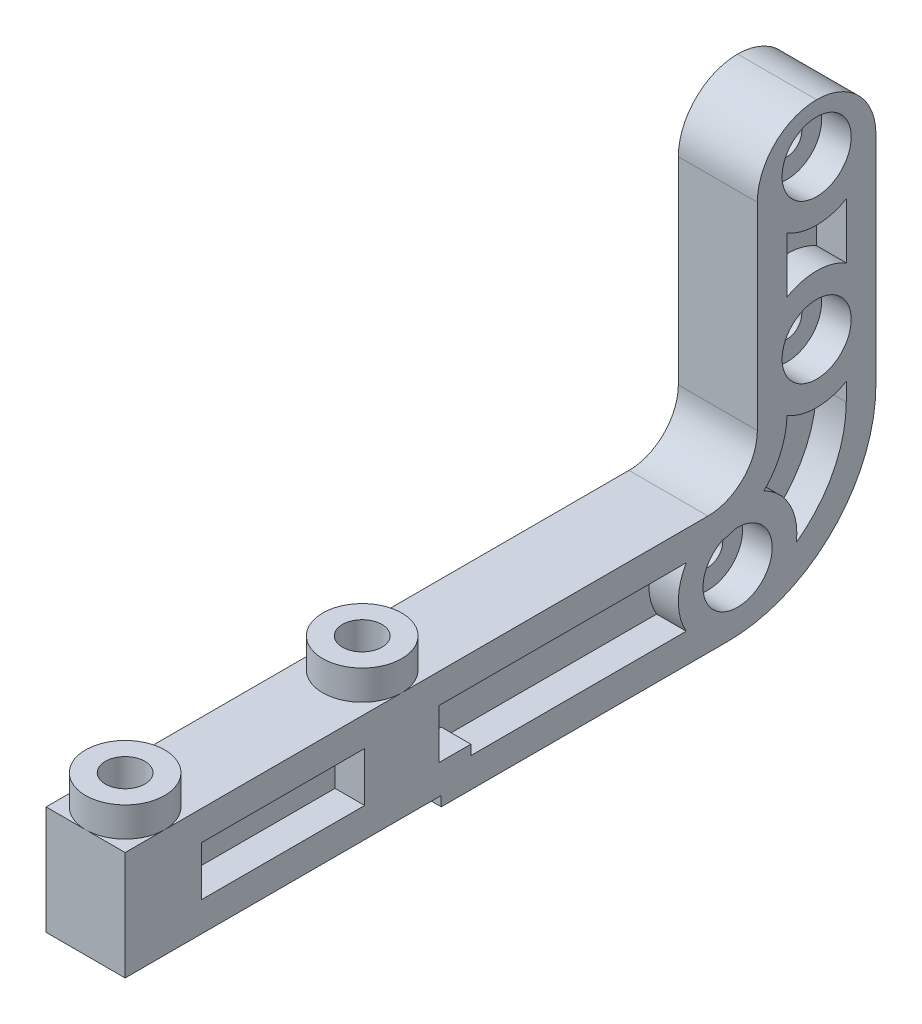
from build123d import *

# Parameters (mm, degrees)
SKETCH1_R           = 1.5
SKETCH1_W           = 12
SKETCH1_H           = 31
BOSS_EXTRUDE1_DEPTH = 8
FILLET1_R           = 6
FILLET2_R           = 15
FILLET3_R           = 5
SKETCH2_R           = 2
CUT_EXTRUDE1_DEPTH  = 50.689032995
BOSS_EXTRUDE2_START = 3
SKETCH3_R           = 4
SKETCH3_R_2         = 2
BOSS_EXTRUDE2_DEPTH = 3
CUT_EXTRUDE2_START  = -3
SKETCH4_W           = 16.5
SKETCH4_H           = 5
SKETCH4_R           = 1.5
CUT_EXTRUDE2_DEPTH  = 3


with BuildPart() as part:
    # Sketch1 → Boss-Extrude1 (new body)
    # profile 1 of 2: a face of its own
    with BuildSketch(Plane(origin=(0, 0, 0), x_dir=(0, 0, -1), z_dir=(1, 0, 0))):
        Polygon((-6, -5), (-6, -6), (38, -6), (38, 6), (26, 6), (-38, 6), (-38, -5), align=None)
        with Locations((24, 0)):
            Circle(SKETCH1_R, mode=Mode.SUBTRACT)
    # profile 2 of 2: a face of its own
    with BuildSketch(Plane(origin=(0, 0, 0), x_dir=(0, 0, -1), z_dir=(1, 0, 0))):
        with Locations((32, 21.5)):
            Rectangle(SKETCH1_W, SKETCH1_H)
        with Locations((32, 16)):
            Circle(SKETCH1_R, mode=Mode.SUBTRACT)
        with Locations((32, 32)):
            Circle(SKETCH1_R, mode=Mode.SUBTRACT)
    extrude(amount=BOSS_EXTRUDE1_DEPTH)

    # Fillet1
    fillet1_edges = [part.edges().sort_by_distance(p)[0] for p in [
        (4, 37, -26),
        (4, 37, -38),
    ]]
    fillet(fillet1_edges, radius=FILLET1_R - 0.0001)  # a hair under: the kernel refuses the full size

    # Fillet2
    fillet2_edges = [part.edges().sort_by_distance(p)[0] for p in [
        (4, -6, -38),
    ]]
    fillet(fillet2_edges, radius=FILLET2_R)

    # Fillet3
    fillet3_edges = [part.edges().sort_by_distance(p)[0] for p in [
        (4, 6, -26),
    ]]
    fillet(fillet3_edges, radius=FILLET3_R)

    # Sketch2 → Cut-Extrude1 (cut, through all)
    with BuildSketch(Plane(origin=(0, 6, 0), x_dir=(1, 0, 0), z_dir=(0, 1, 0))):
        with Locations(Location((4, -34, 0), (0, 0, 270))):
            Circle(SKETCH2_R)
        with Locations(Location((4, -10, 0), (0, 0, 270))):
            Circle(SKETCH2_R)
    extrude(amount=-CUT_EXTRUDE1_DEPTH, mode=Mode.SUBTRACT)

    # Sketch3 → Boss-Extrude2 (add)
    # profile 1 of 2: a face of its own
    with BuildSketch(Plane(origin=(0, 6, 0), x_dir=(1, 0, 0), z_dir=(0, 1, 0)).offset(BOSS_EXTRUDE2_START)):
        with Locations(Location((4, -10, 0), (0, 0, 180))):
            Circle(SKETCH3_R)
        with Locations(Location((4, -10, 0), (0, 0, 270))):
            Circle(SKETCH3_R_2, mode=Mode.SUBTRACT)
    # profile 2 of 2: a face of its own
    with BuildSketch(Plane(origin=(0, 6, 0), x_dir=(1, 0, 0), z_dir=(0, 1, 0)).offset(BOSS_EXTRUDE2_START)):
        with Locations(Location((4, -34, 0), (0, 0, 270))):
            Circle(SKETCH3_R)
        with Locations(Location((4, -34, 0), (0, 0, 270))):
            Circle(SKETCH3_R_2, mode=Mode.SUBTRACT)
    extrude(amount=-BOSS_EXTRUDE2_DEPTH)

    # Sketch4 → Cut-Extrude2 (cut)
    # profile 1 of 11: a face of its own
    with BuildSketch(Plane(origin=(8, 0, 0), x_dir=(0, 0, -1), z_dir=(1, 0, 0)).offset(CUT_EXTRUDE2_START)):
        with BuildLine():
            Line((-6.25, 3), (-6.25, -2))
            Line((-6.25, -2), (-3, -2))
            Line((-3, -2), (-3, -3))
            Line((-3, -3), (18.803847577, -3))
            ThreePointArc((18.803847577, -3), (18, 0), (18.803847577, 3))
            Line((18.803847577, 3), (-6.25, 3))
        make_face()
    # profile 2 of 11: a face of its own
    with BuildSketch(Plane(origin=(8, 0, 0), x_dir=(0, 0, -1), z_dir=(1, 0, 0)).offset(CUT_EXTRUDE2_START)):
        with Locations((-22, 0.5)):
            Rectangle(SKETCH4_W, SKETCH4_H)
    # profile 3 of 11: a face of its own
    with BuildSketch(Plane(origin=(8, 0, 0), x_dir=(0, 0, -1), z_dir=(1, 0, 0)).offset(CUT_EXTRUDE2_START)):
        with BuildLine():
            ThreePointArc((28.997628386, 10.805217551), (28.359995566, 7.86464272), (26.681204439, 5.367601211))
            ThreePointArc((26.681204439, 5.367601211), (29.103294359, 3.155374254), (30, 0))
            ThreePointArc((30, 0), (29.98714269, -0.392584271), (29.948625864, -0.783486015))
            ThreePointArc((29.948625864, -0.783486015), (33.662633595, 3.494707563), (35, 9))
            Line((35, 9), (35, 10.803847577))
            ThreePointArc((35, 10.803847577), (31.998630567, 10.000000156), (28.997628386, 10.805217551))
        make_face()
    # profile 4 of 11: a face of its own
    with BuildSketch(Plane(origin=(8, 0, 0), x_dir=(0, 0, -1), z_dir=(1, 0, 0)).offset(CUT_EXTRUDE2_START)):
        with BuildLine():
            Line((29, 26.803847577), (29, 21.196152423))
            ThreePointArc((29, 21.196152423), (32, 22), (35, 21.196152423))
            Line((35, 21.196152423), (35, 26.803847577))
            ThreePointArc((35, 26.803847577), (32, 26), (29, 26.803847577))
        make_face()
    # profile 5 of 11: a face of its own
    with BuildSketch(Plane(origin=(8, 0, 0), x_dir=(0, 0, -1), z_dir=(1, 0, 0)).offset(CUT_EXTRUDE2_START)):
        with BuildLine():
            Line((29, 31), (29, 30.197224362))
            ThreePointArc((29, 30.197224362), (32, 28.5), (35, 30.197224362))
            Line((35, 30.197224362), (35, 31))
            ThreePointArc((35, 31), (34.121320344, 33.121320344), (32, 34))
            ThreePointArc((32, 34), (29.878679656, 33.121320344), (29, 31))
        make_face()
        with Locations((32, 32)):
            Circle(SKETCH4_R, mode=Mode.SUBTRACT)
    # profile 6 of 11: a face of its own
    with BuildSketch(Plane(origin=(8, 0, 0), x_dir=(0, 0, -1), z_dir=(1, 0, 0)).offset(CUT_EXTRUDE2_START)):
        with BuildLine():
            ThreePointArc((35.5, 32), (31.064585653, 35.372684391), (29, 30.197224362))
            Line((29, 30.197224362), (29, 31))
            ThreePointArc((29, 31), (29.878679656, 33.121320344), (32, 34))
            ThreePointArc((32, 34), (34.121320344, 33.121320344), (35, 31))
            Line((35, 31), (35, 30.197224362))
            ThreePointArc((35, 30.197224362), (35.372684391, 31.064585653), (35.5, 32))
        make_face()
    # profile 7 of 11: a face of its own
    with BuildSketch(Plane(origin=(8, 0, 0), x_dir=(0, 0, -1), z_dir=(1, 0, 0)).offset(CUT_EXTRUDE2_START)):
        with BuildLine():
            ThreePointArc((35, 17.802775638), (32, 19.5), (29, 17.802775638))
            Line((29, 17.802775638), (29, 14.197224362))
            ThreePointArc((29, 14.197224362), (32, 12.5), (35, 14.197224362))
            Line((35, 14.197224362), (35, 17.802775638))
        make_face()
        with Locations((32, 16)):
            Circle(SKETCH4_R, mode=Mode.SUBTRACT)
    # profile 8 of 11: a face of its own
    with BuildSketch(Plane(origin=(8, 0, 0), x_dir=(0, 0, -1), z_dir=(1, 0, 0)).offset(CUT_EXTRUDE2_START)):
        with BuildLine():
            Line((35, 17.802775638), (35, 14.197224362))
            ThreePointArc((35, 14.197224362), (35.372684391, 15.064585653), (35.5, 16))
            ThreePointArc((35.5, 16), (35.372684391, 16.935414347), (35, 17.802775638))
        make_face()
    # profile 9 of 11: a face of its own
    with BuildSketch(Plane(origin=(8, 0, 0), x_dir=(0, 0, -1), z_dir=(1, 0, 0)).offset(CUT_EXTRUDE2_START)):
        with BuildLine():
            Line((29, 14.197224362), (29, 17.802775638))
            ThreePointArc((29, 17.802775638), (28.5, 16), (29, 14.197224362))
        make_face()
    # profile 10 of 11: a face of its own
    with BuildSketch(Plane(origin=(8, 0, 0), x_dir=(0, 0, -1), z_dir=(1, 0, 0)).offset(CUT_EXTRUDE2_START)):
        with BuildLine():
            ThreePointArc((23.761948832, 3.491895136), (23.104939246, 3.28188943), (22.432281937, 3.12925871))
            ThreePointArc((22.432281937, 3.12925871), (20.50257094, 0.134126691), (22.197224362, -3))
            Line((22.197224362, -3), (23, -3))
            ThreePointArc((23, -3), (24.748137439, -2.87198448), (26.458976757, -2.490669249))
            ThreePointArc((26.458976757, -2.490669249), (27.229273808, -1.349737262), (27.5, 0))
            ThreePointArc((27.5, 0), (26.389228004, 2.557653132), (23.761948832, 3.491895136))
        make_face()
        with Locations((24, 0)):
            Circle(SKETCH4_R, mode=Mode.SUBTRACT)
    # profile 11 of 11: a face of its own
    with BuildSketch(Plane(origin=(8, 0, 0), x_dir=(0, 0, -1), z_dir=(1, 0, 0)).offset(CUT_EXTRUDE2_START)):
        with BuildLine():
            Line((23, -3), (22.197224362, -3))
            ThreePointArc((22.197224362, -3), (24.415336527, -3.475269136), (26.458976757, -2.490669249))
            ThreePointArc((26.458976757, -2.490669249), (24.748137439, -2.87198448), (23, -3))
        make_face()
    cut_extrude2 = extrude(amount=CUT_EXTRUDE2_DEPTH, mode=Mode.SUBTRACT)

    # Mirror1: Cut-Extrude2 across plane
    add(cut_extrude2.mirror(Plane.ZY.offset(-4)), mode=Mode.SUBTRACT)


solid = part.part
